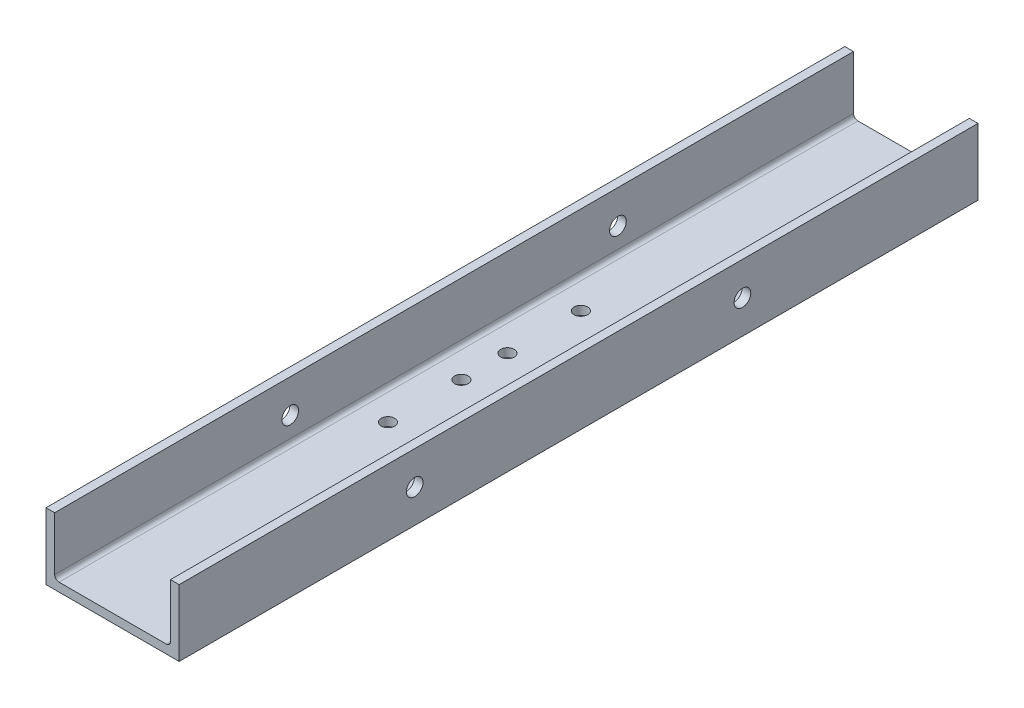
from build123d import *

# Parameters (mm, degrees)
BOSS_EXTRUDE1_DEPTH = 152.4
FILLET1_R           = 1.651
SKETCH4_R           = 2.585
CUT_EXTRUDE1_DEPTH  = 10
SKETCH9_R           = 3.18
CUT_EXTRUDE2_DEPTH  = 30


with BuildPart() as part:
    # Sketch3 → Boss-Extrude1 (new, symmetric)
    with BuildSketch(Plane.XY):
        Polygon((-25.4, 12.7), (-25.4, -12.7), (25.4, -12.7), (25.4, 12.7), (22.098, 12.7), (22.098, -9.398), (-22.098, -9.398), (-22.098, 12.7), align=None)
    extrude(amount=BOSS_EXTRUDE1_DEPTH, both=True)

    # Fillet1
    fillet1_edges = [part.edges().sort_by_distance(p)[0] for p in [
        (22.098, -9.398, 0),
        (-22.098, -9.398, 0),
    ]]
    fillet(fillet1_edges, radius=FILLET1_R)

    # Sketch4 → Cut-Extrude1 (cut)
    with BuildSketch(Plane(origin=(0, -9.398, 0), x_dir=(1, 0, 0), z_dir=(0, 1, 0))):
        with Locations((-10.530435142, 8.79)):
            Circle(SKETCH4_R)
        with Locations((10.469564858, 8.79)):
            Circle(SKETCH4_R)
        with Locations((-10.530435142, 36.79)):
            Circle(SKETCH4_R)
        with Locations((10.469564858, 36.79)):
            Circle(SKETCH4_R)
        with Locations((-10.530435142, -36.79)):
            Circle(SKETCH4_R)
        with Locations((10.469564858, -36.79)):
            Circle(SKETCH4_R)
        with Locations((10.469564858, -8.79)):
            Circle(SKETCH4_R)
        with Locations((-10.530435142, -8.79)):
            Circle(SKETCH4_R)
    extrude(amount=-CUT_EXTRUDE1_DEPTH, mode=Mode.SUBTRACT)

    # Sketch9 → Cut-Extrude2 (cut, symmetric)
    with BuildSketch(Plane(origin=(0, 0, 0), x_dir=(0, 0, -1), z_dir=(1, 0, 0))):
        with Locations((-62.52, 0)):
            Circle(SKETCH9_R)
        with Locations((62.52, 0)):
            Circle(SKETCH9_R)
    extrude(amount=CUT_EXTRUDE2_DEPTH, both=True, mode=Mode.SUBTRACT)


solid = part.part
